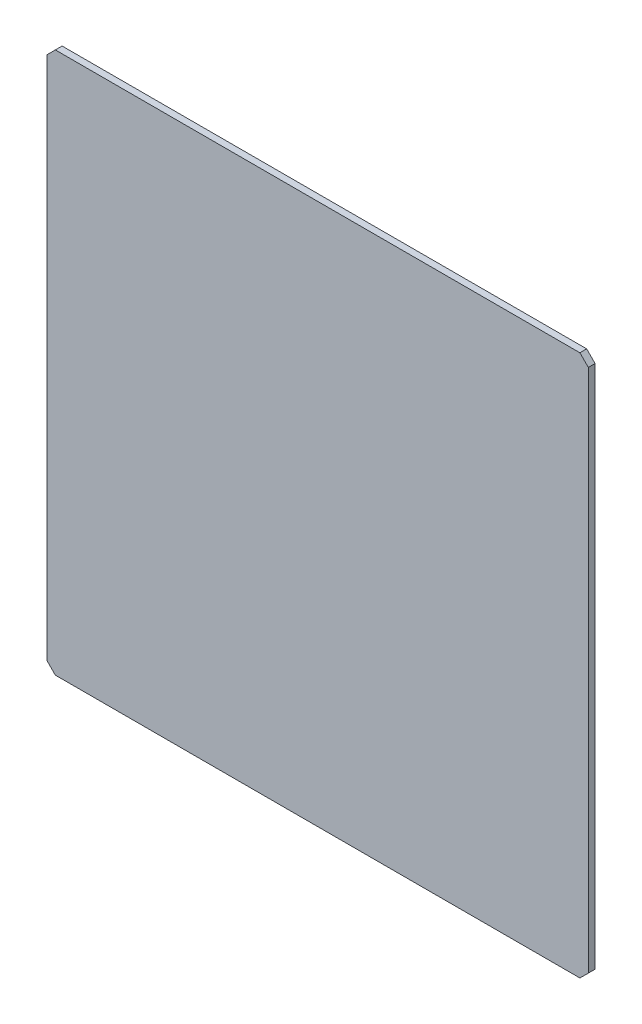
from build123d import *

# Parameters (mm, degrees)
SKETCH2_W           = 320
SKETCH2_H           = 320
BOSS_EXTRUDE1_DEPTH = 4
CHAMFER1_SIZE       = 5


with BuildPart() as part:
    # Sketch2 → Boss-Extrude1 (new body)
    with BuildSketch(Plane.XY):
        Rectangle(SKETCH2_W, SKETCH2_H)
    extrude(amount=BOSS_EXTRUDE1_DEPTH)

    # Chamfer1
    chamfer1_edges = [part.edges().sort_by_distance(p)[0] for p in [
        (160, -160, 2),
        (160, 160, 2),
        (-160, -160, 2),
        (-160, 160, 2),
    ]]
    chamfer(chamfer1_edges, length=CHAMFER1_SIZE)


solid = part.part
